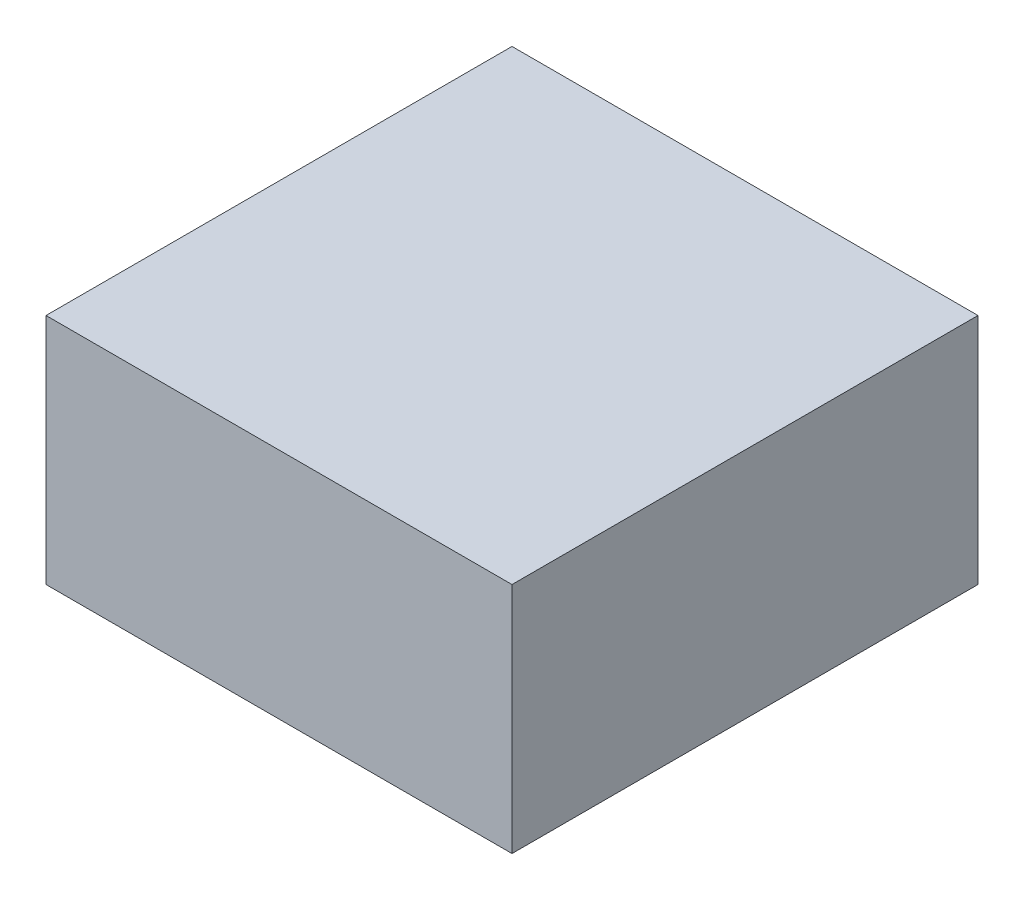
from build123d import *

# Parameters (mm, degrees)
SKETCH1_W           = 20
SKETCH1_H           = 20
BOSS_EXTRUDE1_DEPTH = 10


# Read off the part's stored shape, not the designer's step: Cavity1
with BuildPart() as part:
    # Sketch1 → Boss-Extrude1 (new body)
    with BuildSketch(Plane(origin=(0, 0, 0), x_dir=(1, 0, 0), z_dir=(0, 1, 0))):
        Rectangle(SKETCH1_W, SKETCH1_H)
    extrude(amount=BOSS_EXTRUDE1_DEPTH)

    # Cavity1 outline → Cavity1 (revolve, cut)
    with BuildSketch(Plane.XY):
        with BuildLine():
            Line((2.5, 5.9), (0, 5.9))
            Line((0, 5.9), (0, 0))
            Line((0, 0), (6, 0))
            Line((6, 0), (6, 3))
            ThreePointArc((6, 3), (4.909210346, 5.920864533), (2.5, 7.9))
            Line((2.5, 7.9), (2.5, 5.9))
        make_face()
    revolve(axis=Axis((0, 0, 0), (0, 1, 0)), mode=Mode.SUBTRACT)


solid = part.part
